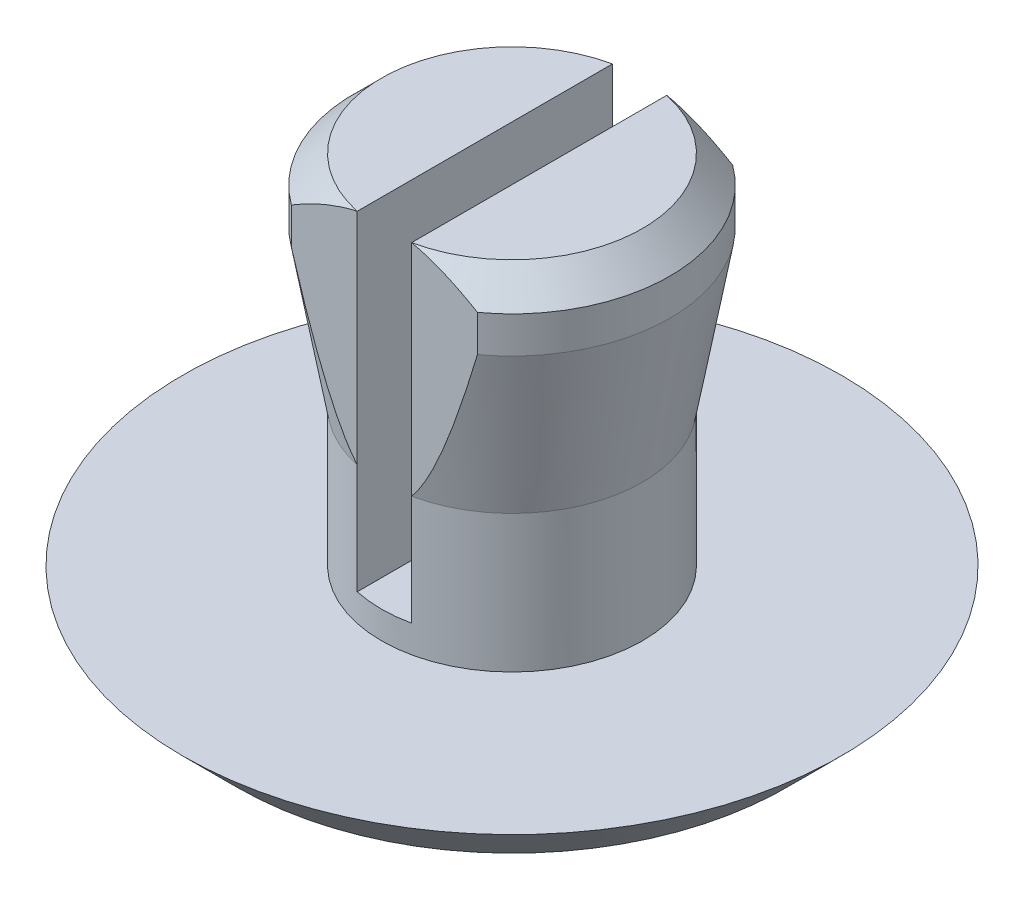
from build123d import *

# Parameters (mm, degrees)
SKETCH1_R           = 4.75
BOSS_EXTRUDE1_DEPTH = 13
SKETCH2_R           = 12
BOSS_EXTRUDE2_DEPTH = 2
CHAMFER1_SIZE       = 2
CUT_EXTRUDE1_START  = -12
CUT_EXTRUDE1_DEPTH  = 12
BOSS_EXTRUDE3_DEPTH = 2
CHAMFER3_SIZE       = 6
CHAMFER3_SIZE_2     = 1.057961884
CHAMFER4_SIZE       = 1


# Some blends are built 0.0001 mm under size
with BuildPart() as part:
    # Sketch1 → Boss-Extrude1 (new body)
    with BuildSketch(Plane(origin=(0, 0, 0), x_dir=(1, 0, 0), z_dir=(0, 1, 0))):
        with Locations(Location((0, 0, 0), (0, 0, 90))):
            Circle(SKETCH1_R)
    extrude(amount=BOSS_EXTRUDE1_DEPTH)

    # Sketch2 → Boss-Extrude2 (add)
    with BuildSketch(Plane.XZ):
        with Locations(Location((0, 0, 0), (0, 0, 270))):
            Circle(SKETCH2_R)
    extrude(amount=BOSS_EXTRUDE2_DEPTH)

    # Chamfer1
    chamfer1_edges = [part.edges().sort_by_distance(p)[0] for p in [
        (0, -2, 12),
    ]]
    chamfer(chamfer1_edges, length=CHAMFER1_SIZE - 0.0001)  # a hair under: the kernel refuses the full size

    # Sketch4 → Cut-Extrude1 (cut)
    with BuildSketch(Plane(origin=(0, 13, 0), x_dir=(1, 0, 0), z_dir=(0, 1, 0)).offset(CUT_EXTRUDE1_START)):
        with BuildLine():
            Line((-0.989583333, -4.645774944), (-0.989583333, 4.645774944))
            ThreePointArc((-0.989583333, 4.645774944), (0, 4.75), (0.989583333, 4.645774944))
            Line((0.989583333, 4.645774944), (0.989583333, -4.645774944))
            ThreePointArc((0.989583333, -4.645774944), (0, -4.75), (-0.989583333, -4.645774944))
        make_face()
    extrude(amount=CUT_EXTRUDE1_DEPTH, mode=Mode.SUBTRACT)

    # Sketch5 → Boss-Extrude3 (add)
    with BuildSketch(Plane(origin=(0, 13, 0), x_dir=(1, 0, 0), z_dir=(0, 1, 0))):
        with BuildLine():
            Line((1.197916667, -4.645774944), (3.388107905, -4.645774944))
            ThreePointArc((3.388107905, -4.645774944), (5.75, 0), (3.388107905, 4.645774944))
            Line((3.388107905, 4.645774944), (1.197916667, 4.645774944))
            Line((1.197916667, 4.645774944), (0.989583333, 4.645774944))
            Line((0.989583333, 4.645774944), (0.989583333, -4.645774944))
            Line((0.989583333, -4.645774944), (1.197916667, -4.645774944))
        make_face()
        with BuildLine():
            Line((-1.197916667, -4.645774944), (-3.388107905, -4.645774944))
            ThreePointArc((-3.388107905, -4.645774944), (-5.75, 0), (-3.388107905, 4.645774944))
            Line((-3.388107905, 4.645774944), (-1.197916667, 4.645774944))
            Line((-1.197916667, 4.645774944), (-0.989583333, 4.645774944))
            Line((-0.989583333, 4.645774944), (-0.989583333, -4.645774944))
            Line((-0.989583333, -4.645774944), (-1.197916667, -4.645774944))
        make_face()
    extrude(amount=-BOSS_EXTRUDE3_DEPTH)

    # Chamfer3
    # the kernel refuses this chamfer: 6, 1.057961884 mm, written as the material it adds along each edge
    with BuildSketch(Plane(origin=(0, 11, 0), x_dir=(-0.9999950652018581, 0, -0.0031415874858794902), z_dir=(-0.0031415874858794902, 0, 0.9999950652018581))) as chamfer3_piece_1_section:
        Polygon((4.75, CHAMFER3_SIZE), (4.75 + CHAMFER3_SIZE_2, 0), (4.75, 0), align=None)
    chamfer3_piece_1 = revolve(axis=Axis((0, 11, 0), (0, -1, 0)), revolution_arc=359.64, mode=Mode.PRIVATE)
    chamfer3_piece_1 = split(chamfer3_piece_1, bisect_by=Plane(origin=(-4.007024844, 8.962519636, 4.645774944), z_dir=(0, 0, -1)), keep=Keep.TOP, mode=Mode.PRIVATE)
    chamfer3_piece_1 = split(chamfer3_piece_1, bisect_by=Plane(origin=(-4.007024844, 8.962519636, -4.645774944), z_dir=(0, 0, 1)), keep=Keep.TOP, mode=Mode.PRIVATE)
    chamfer3_piece_1 = chamfer3_piece_1 & Plane(origin=(0, 8.962519636, 0), x_dir=(0.5892361573319569, 0, 0.8079608597529149), z_dir=(0, 1, 0)) * Cylinder(5.75, 24, mode=Mode.PRIVATE)
    add(chamfer3_piece_1)
    with BuildSketch(Plane(origin=(0, 11, 0), x_dir=(0.9999950652018581, 0, 0.003141587485879146), z_dir=(0.003141587485879146, 0, -0.9999950652018581))) as chamfer3_piece_2_section:
        Polygon((4.75, CHAMFER3_SIZE), (4.75 + CHAMFER3_SIZE_2, 0), (4.75, 0), align=None)
    chamfer3_piece_2 = revolve(axis=Axis((0, 11, 0), (0, -1, 0)), revolution_arc=359.64, mode=Mode.PRIVATE)
    chamfer3_piece_2 = split(chamfer3_piece_2, bisect_by=Plane(origin=(4.007024844, 8.962519636, 4.645774944), z_dir=(0, 0, -1)), keep=Keep.TOP, mode=Mode.PRIVATE)
    chamfer3_piece_2 = split(chamfer3_piece_2, bisect_by=Plane(origin=(4.007024844, 8.962519636, -4.645774944), z_dir=(0, 0, 1)), keep=Keep.TOP, mode=Mode.PRIVATE)
    chamfer3_piece_2 = chamfer3_piece_2 & Plane(origin=(0, 8.962519636, 0), x_dir=(0.5892361573319569, 0, 0.8079608597529149), z_dir=(0, 1, 0)) * Cylinder(5.75, 24, mode=Mode.PRIVATE)
    add(chamfer3_piece_2)

    # Chamfer4
    chamfer4_edges = [part.edges().sort_by_distance(p)[0] for p in [
        (5.75, 13, 0),
        (-5.75, 13, 0),
    ]]
    chamfer(chamfer4_edges, length=CHAMFER4_SIZE)


solid = part.part
